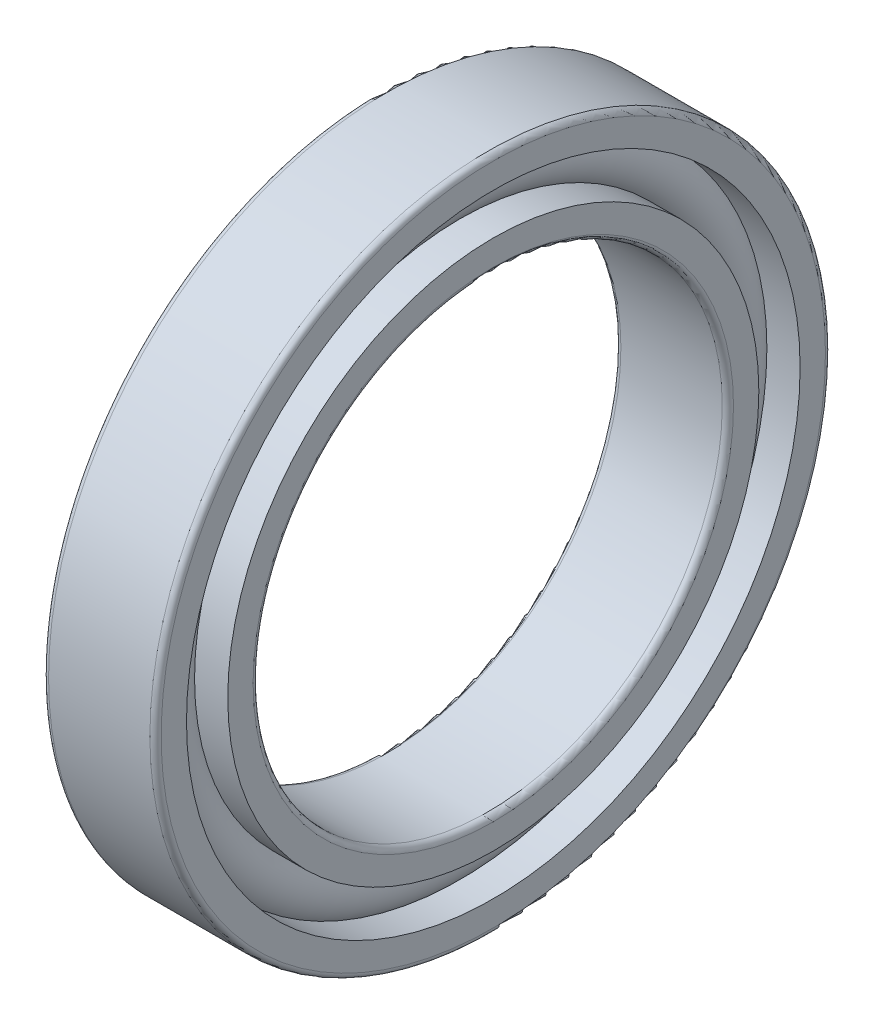
from build123d import *

# Parameters (mm, degrees)
CAGSPISKE_W     = 0.66
CAGSPISKE_H     = 1.1
CAGESPINE_ANGLE = 0.001
BALSIMSKE_R     = 3.3


with BuildPart() as part:
    # CagSpiSke → CageSpine (revolve)
    with BuildSketch(Plane.XY):
        with Locations((0, 30.5)):
            Rectangle(CAGSPISKE_W, CAGSPISKE_H)
    revolve(axis=Axis((-20.6375, 0, 0), (-1, 0, 0)), revolution_arc=CAGESPINE_ANGLE)

    # BalSimSke → BallsSimplified (revolve)
    with BuildSketch(Plane.XY):
        with Locations((0, 30.5)):
            Circle(BALSIMSKE_R)
    revolve(axis=Axis((-10, 0, 0), (1, 0, 0)))

    # InnRacSke → InnerRace (revolve)
    with BuildSketch(Plane.XY):
        with BuildLine():
            Line((-2.426030709, 28.3), (-6, 28.3))
            Line((-6, 28.3), (-6, 25.6))
            ThreePointArc((-6, 25.6), (-5.824264069, 25.175735931), (-5.4, 25))
            Line((-5.4, 25), (5.4, 25))
            ThreePointArc((5.4, 25), (5.824264069, 25.175735931), (6, 25.6))
            Line((6, 25.6), (6, 28.3))
            Line((6, 28.3), (2.426030709, 28.3))
            ThreePointArc((2.426030709, 28.3), (0, 27.225), (-2.426030709, 28.3))
        make_face()
    revolve(axis=Axis((-20.6375, 0, 0), (1, 0, 0)))

    # OutRacSke → OuterRace (revolve)
    with BuildSketch(Plane.XY):
        with BuildLine():
            Line((-2.426030709, 32.7), (-6, 32.7))
            Line((-6, 32.7), (-6, 35.4))
            ThreePointArc((-6, 35.4), (-5.824264069, 35.824264069), (-5.4, 36))
            Line((-5.4, 36), (5.4, 36))
            ThreePointArc((5.4, 36), (5.824264069, 35.824264069), (6, 35.4))
            Line((6, 35.4), (6, 32.7))
            Line((6, 32.7), (2.426030709, 32.7))
            ThreePointArc((2.426030709, 32.7), (0, 33.775), (-2.426030709, 32.7))
        make_face()
    revolve(axis=Axis((-20.6375, 0, 0), (1, 0, 0)))


solid = part.part
